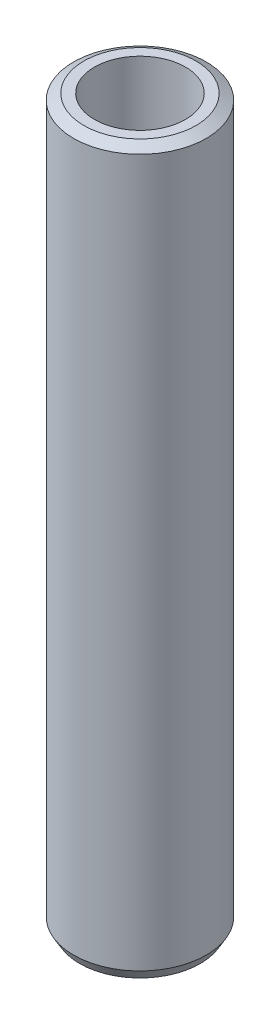
from build123d import *
from OCP.BRepFilletAPI import BRepFilletAPI_MakeChamfer

# Parameters (mm, degrees)
SKETCH1_R           = 55
BOSS_EXTRUDE1_DEPTH = 600
SKETCH2_R           = 37.71202819
CUT_EXTRUDE1_DEPTH  = 606.020660804
CHAMFER1_SIZE       = 4.946028609
CHAMFER1_SIZE2      = 8.566772846


with BuildPart() as part:
    # Sketch1 → Boss-Extrude1 (new body)
    with BuildSketch(Plane(origin=(0, 0, 0), x_dir=(1, 0, 0), z_dir=(0, 1, 0))):
        Circle(SKETCH1_R)
    extrude(amount=BOSS_EXTRUDE1_DEPTH)

    # Sketch2 → Cut-Extrude1 (cut, through all)
    with BuildSketch(Plane(origin=(0, 0, 0), x_dir=(1, 0, 0), z_dir=(0, 1, 0))):
        Circle(SKETCH2_R)
    extrude(amount=CUT_EXTRUDE1_DEPTH, mode=Mode.SUBTRACT)

    # Chamfer1: one chamfer whose edges measure the first distance from different faces: ONE call of the kernel's chamfer builder (chamfer() names one face for all edges)
    chamfer1_edges_1 = [part.edges().sort_by_distance(p)[0] for p in [
        (-55, 600, 0),
    ]]
    chamfer1_side_1 = [part.faces().sort_by_distance(p)[0] for p in [
        (-55, 300, 0),
    ]]
    chamfer1_edges_2 = [part.edges().sort_by_distance(p)[0] for p in [
        (-55, 0, 0),
    ]]
    chamfer1_side_2 = [part.faces().sort_by_distance(p)[0] for p in [
        (-53.444365081, 0, 0),
    ]]
    chamfer1 = BRepFilletAPI_MakeChamfer(part.part.solid().wrapped)
    for e in chamfer1_edges_1:
        chamfer1.Add(CHAMFER1_SIZE, CHAMFER1_SIZE2, e.wrapped, chamfer1_side_1[0].wrapped)  # the first distance lies on this face
    for e in chamfer1_edges_2:
        chamfer1.Add(CHAMFER1_SIZE, CHAMFER1_SIZE2, e.wrapped, chamfer1_side_2[0].wrapped)  # the first distance lies on this face
    add(Compound.cast(chamfer1.Shape()), mode=Mode.REPLACE)


solid = part.part
